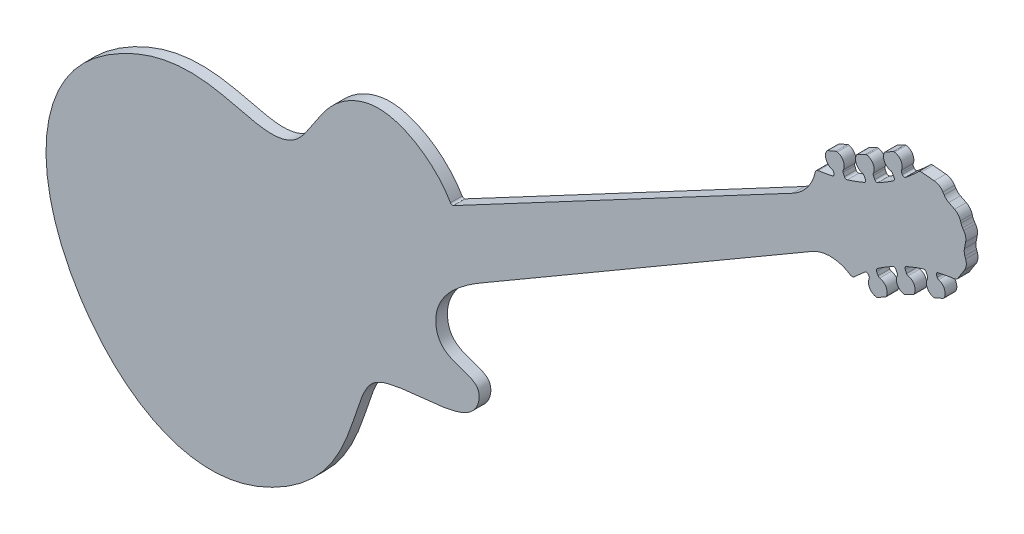
from build123d import *

# Parameters (mm, degrees)
SKIZZE2_W                           = 841
SKIZZE2_H                           = 594
AUFSATZ_LINEAR_AUSTRAGEN1_DEPTH     = 5
SCHNITT_LINEAR_START                = -10
SCHNITT_LINEAR_AUSTRAGEN1_OUTLINE_W = 841
SCHNITT_LINEAR_AUSTRAGEN1_OUTLINE_H = 594
SCHNITT_LINEAR_AUSTRAGEN1_DEPTH     = 10
VERRUNDUNG1_R                       = 2
VERRUNDUNG2_R                       = 3
VERRUNDUNG3_R                       = 10
VERRUNDUNG4_R                       = 2


# Read off the part's stored shape, not the designer's step: Schnitt-Linear austragen1
with BuildPart() as part:
    # Skizze2 → Aufsatz-Linear austragen1 (new, symmetric)
    with BuildSketch(Plane.XY):
        Rectangle(SKIZZE2_W, SKIZZE2_H)
    extrude(amount=AUFSATZ_LINEAR_AUSTRAGEN1_DEPTH, both=True)

    # Schnitt-Linear austragen1 outline → Schnitt-Linear austragen1 (cut)
    with BuildSketch(Plane.XY.offset(5).offset(SCHNITT_LINEAR_START)):
        Rectangle(SCHNITT_LINEAR_AUSTRAGEN1_OUTLINE_W, SCHNITT_LINEAR_AUSTRAGEN1_OUTLINE_H)
        with BuildLine():
            add(Edge.make_bspline(
                [(-46.070134676, 31.592828452), (-57.803492393, 53.658712352), (-94.455782402, 79.845036722), (-158.34361712, 59.161383964), (-166.899333837, 14.30589872), (-220.39600599, 0.994058676), (-271.66273811, 39.520833327), (-396.103201952, -37.408808839), (-404.274335311, -126.227240483), (-338.879906572, -241.256809884), (-263.153026558, -288.183802576), (-126.991203132, -216.762078957), (-132.835145955, -138.586133123), (-80.422728506, -120.061467648), (-25.616281184, -126.365685224), (-19.782335113, -81.839104844), (-57.506172353, -88.150246671), (-61.489821321, -43.376836902), (-41.761839371, -25.332850566), (-20.460334335, -12.923068286)],
                knots=[0, 0, 0, 0, 0.066463161, 0.084950513, 0.173770969, 0.20099199, 0.329939699, 0.358725215, 0.460061632, 0.48420503, 0.576015797, 0.600149537, 0.701408688, 0.727631635, 0.836156062, 0.858572313, 0.929377888, 0.944405726, 1, 1, 1, 1], degree=3))
            Line((-46.070134676, 31.592828452), (246.267714639, 186.997962048))
            ThreePointArc((246.267714639, 186.997962048), (259.257809032, 198.37181085), (265.830492974, 214.337612261))
            ThreePointArc((265.830492974, 214.337612261), (274.144256626, 215.597628014), (282.375777438, 217.3147101))
            Line((282.375777438, 217.3147101), (280.663242022, 221.286624391))
            ThreePointArc((280.663242022, 221.286624391), (274.796738789, 225.853617671), (275.503121702, 233.254584566))
            Line((275.503121702, 233.254584566), (283.707982283, 236.792202271))
            ThreePointArc((283.707982283, 236.792202271), (289.549983069, 232.214644487), (288.868102604, 224.824242097))
            Line((288.868102604, 224.824242097), (291.09416587, 219.661293395))
            ThreePointArc((291.09416587, 219.661293395), (300.273415324, 222.74795326), (309.237859535, 226.411944206))
            Line((309.237859535, 226.411944206), (306.754495799, 231.511017708))
            ThreePointArc((306.754495799, 231.511017708), (300.683614697, 235.802601384), (301.047929545, 243.228270546))
            Line((301.047929545, 243.228270546), (309.080912988, 247.140514557))
            ThreePointArc((309.080912988, 247.140514557), (315.127804925, 242.837247616), (314.787479242, 235.423261719))
            Line((314.787479242, 235.423261719), (317.286687835, 230.291654081))
            ThreePointArc((317.286687835, 230.291654081), (325.73467707, 235.020539958), (333.86503352, 240.276792211))
            Line((333.86503352, 240.276792211), (331.080132618, 245.382452228))
            ThreePointArc((331.080132618, 245.382452228), (324.84121723, 249.402271033), (324.839263922, 256.824063582))
            Line((324.839263922, 256.824063582), (332.683276153, 261.102608699))
            ThreePointArc((332.683276153, 261.102608699), (338.945616376, 257.095567055), (338.924144849, 249.660997345))
            Line((338.924144849, 249.660997345), (341.123621653, 245.628616598))
            ThreePointArc((341.123621653, 245.628616598), (348.217868014, 251.54719683), (354.940064816, 257.885177073))
            Line((354.940064816, 257.885177073), (372.149037232, 256.251437163))
            Line((372.149037232, 256.251437163), (377.307925109, 248.119667755))
            Line((377.307925109, 248.119667755), (388.536209149, 242.370734654))
            Line((388.536209149, 242.370734654), (390.711494239, 235.156711451))
            Line((390.711494239, 235.156711451), (395.049916421, 228.996184773))
            Line((395.049916421, 228.996184773), (392.653102424, 216.6115218))
            Line((392.653102424, 216.6115218), (395.874483614, 207.536142962))
            Line((395.874483614, 207.536142962), (386.550277499, 192.980147014))
            ThreePointArc((386.550277499, 192.980147014), (377.415688409, 191.595515095), (368.381901663, 189.659379658))
            Line((368.381901663, 189.659379658), (370.200489027, 185.441497168))
            ThreePointArc((370.200489027, 185.441497168), (376.042489812, 180.863939383), (375.360609347, 173.473536993))
            Line((375.360609347, 173.473536993), (367.155748766, 169.935919288))
            ThreePointArc((367.155748766, 169.935919288), (361.289245532, 174.502912567), (361.995628445, 181.903879462))
            Line((361.995628445, 181.903879462), (359.692996483, 187.244415324))
            ThreePointArc((359.692996483, 187.244415324), (350.541833487, 184.084178059), (341.610026657, 180.348711489))
            Line((341.610026657, 180.348711489), (344.10923525, 175.217103851))
            ThreePointArc((344.10923525, 175.217103851), (350.180116352, 170.925520174), (349.815801504, 163.499851013))
            Line((349.815801504, 163.499851013), (341.782818061, 159.587607002))
            ThreePointArc((341.782818061, 159.587607002), (335.735926124, 163.890873943), (336.076251807, 171.30485984))
            Line((336.076251807, 171.30485984), (333.592888071, 176.403933343))
            ThreePointArc((333.592888071, 176.403933343), (325.181048786, 171.605282542), (317.091302963, 166.281552441))
            Line((317.091302963, 166.281552441), (319.783598431, 161.345669331))
            ThreePointArc((319.783598431, 161.345669331), (326.045938653, 157.338627687), (326.024467127, 149.904057977))
            Line((326.024467127, 149.904057977), (318.180454896, 145.62551286))
            ThreePointArc((318.180454896, 145.62551286), (311.941539508, 149.645331666), (311.9395862, 157.067124214))
            Line((311.9395862, 157.067124214), (309.868373127, 160.864354402))
            ThreePointArc((309.868373127, 160.864354402), (303.441237649, 155.442340449), (297.323244126, 149.673765147))
            ThreePointArc((297.323244126, 149.673765147), (280.320132437, 156.142903528), (262.609041888, 151.986844085))
            Line((262.609041888, 151.986844085), (-20.460334335, -12.923068286))
        make_face(mode=Mode.SUBTRACT)
    extrude(amount=SCHNITT_LINEAR_AUSTRAGEN1_DEPTH, mode=Mode.SUBTRACT)

    # Verrundung1
    verrundung1_edges = [part.edges().sort_by_distance(p)[0] for p in [
        (309.237859535, 226.411944206, 0),
        (306.754495799, 231.511017708, 0),
        (301.047929545, 243.228270546, 0),
        (309.080912988, 247.140514557, 0),
        (314.787479242, 235.423261719, 0),
        (317.286687835, 230.291654081, 0),
        (333.86503352, 240.276792211, 0),
        (331.080132618, 245.382452228, 0),
        (324.839263922, 256.824063582, 0),
        (332.683276153, 261.102608699, 0),
        (338.924144849, 249.660997345, 0),
        (341.123621653, 245.628616598, 0),
        (368.381901663, 189.659379658, 0),
        (370.200489027, 185.441497168, 0),
        (375.360609347, 173.473536993, 0),
        (367.155748766, 169.935919288, 0),
        (361.995628445, 181.903879462, 0),
        (359.692996483, 187.244415324, 0),
        (341.610026657, 180.348711489, 0),
        (344.10923525, 175.217103851, 0),
        (349.815801504, 163.499851013, 0),
        (341.782818061, 159.587607002, 0),
        (336.076251807, 171.30485984, 0),
        (333.592888071, 176.403933343, 0),
        (317.091302963, 166.281552441, 0),
        (319.783598431, 161.345669331, 0),
        (326.024467127, 149.904057977, 0),
        (318.180454896, 145.62551286, 0),
        (311.9395862, 157.067124214, 0),
        (309.868373127, 160.864354402, 0),
        (282.375777438, 217.3147101, 0),
        (280.663242022, 221.286624391, 0),
        (275.503121702, 233.254584566, 0),
        (283.707982283, 236.792202271, 0),
        (288.868102604, 224.824242097, 0),
        (291.09416587, 219.661293395, 0),
    ]]
    fillet(verrundung1_edges, radius=VERRUNDUNG1_R)

    # Verrundung2
    verrundung2_edges = [part.edges().sort_by_distance(p)[0] for p in [
        (354.940064816, 257.885177073, 0),
        (386.550277499, 192.980147014, 0),
        (297.323244126, 149.673765147, 0),
        (265.830492974, 214.337612261, 0),
    ]]
    fillet(verrundung2_edges, radius=VERRUNDUNG2_R)

    # Verrundung3
    verrundung3_edges = [part.edges().sort_by_distance(p)[0] for p in [
        (372.149037232, 256.251437163, 0),
        (377.307925109, 248.119667755, 0),
        (388.536209149, 242.370734654, 0),
        (390.711494239, 235.156711451, 0),
        (395.049916421, 228.996184773, 0),
        (392.653102424, 216.6115218, 0),
        (395.874483614, 207.536142962, 0),
    ]]
    fillet(verrundung3_edges, radius=VERRUNDUNG3_R)

    # Verrundung4
    verrundung4_edges = [part.edges().sort_by_distance(p)[0] for p in [
        (-46.070134676, 31.592828452, 0),
    ]]
    fillet(verrundung4_edges, radius=VERRUNDUNG4_R)


solid = part.part
